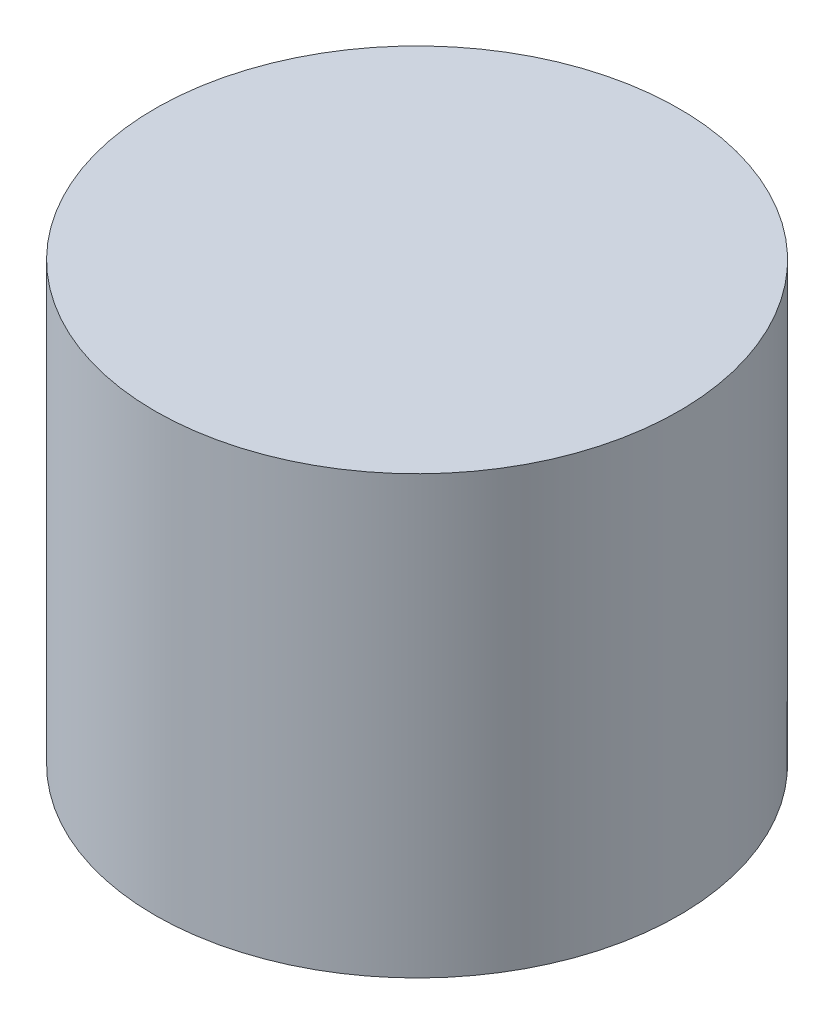
from build123d import *

# Parameters (mm, degrees)
SKETCH1_R           = 90
BOSS_EXTRUDE1_DEPTH = 150


with BuildPart() as part:
    # Sketch1 → Boss-Extrude1 (new body)
    with BuildSketch(Plane(origin=(0, 0, 0), x_dir=(1, 0, 0), z_dir=(0, 1, 0))):
        Circle(SKETCH1_R)
    extrude(amount=BOSS_EXTRUDE1_DEPTH)


solid = part.part
